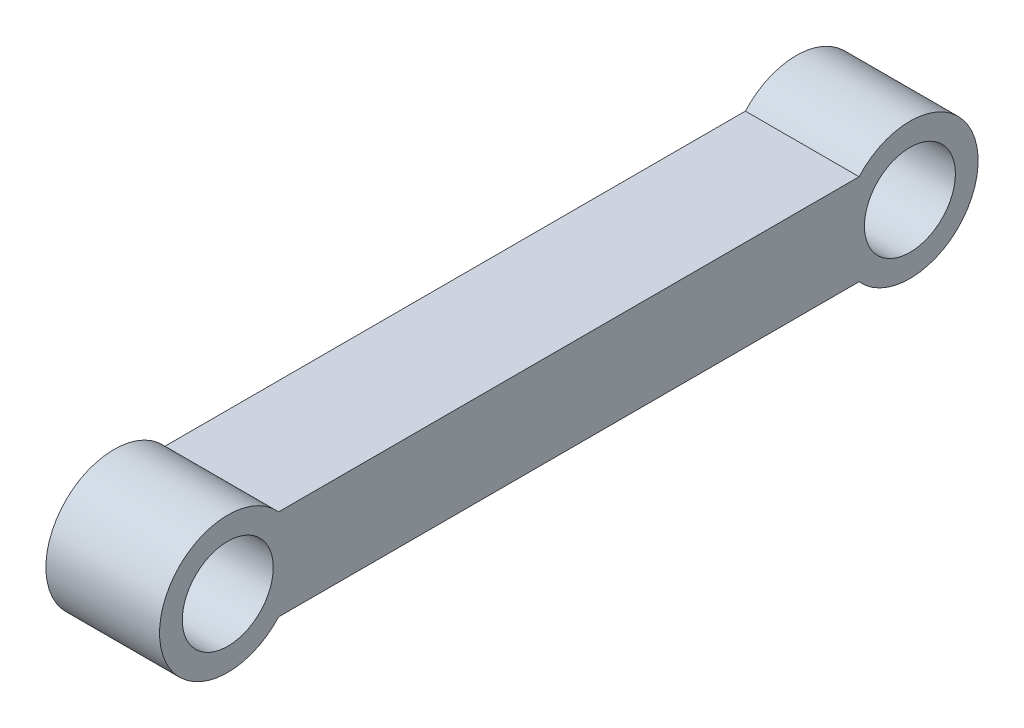
from build123d import *

# Parameters (mm, degrees)
LINKFRAME_R         = 40
BOSS_EXTRUDE1_DEPTH = 100


with BuildPart() as part:
    # LinkFrame → Boss-Extrude1 (new body)
    with BuildSketch(Plane(origin=(0, 0, 0), x_dir=(0, 0, -1), z_dir=(1, 0, 0))):
        with BuildLine():
            Line((-295.62417903, -186.263273145), (214.93310187, -186.263273145))
            ThreePointArc((214.93310187, -186.263273145), (319.65446142, -226.263273145), (214.93310187, -266.263273145))
            Line((214.93310187, -266.263273145), (-295.62417903, -266.263273145))
            ThreePointArc((-295.62417903, -266.263273145), (-400.34553858, -226.263273145), (-295.62417903, -186.263273145))
        make_face()
        with Locations((-340.34553858, -226.263273145)):
            Circle(LINKFRAME_R, mode=Mode.SUBTRACT)
        with Locations((259.65446142, -226.263273145)):
            Circle(LINKFRAME_R, mode=Mode.SUBTRACT)
    extrude(amount=BOSS_EXTRUDE1_DEPTH)


solid = part.part
